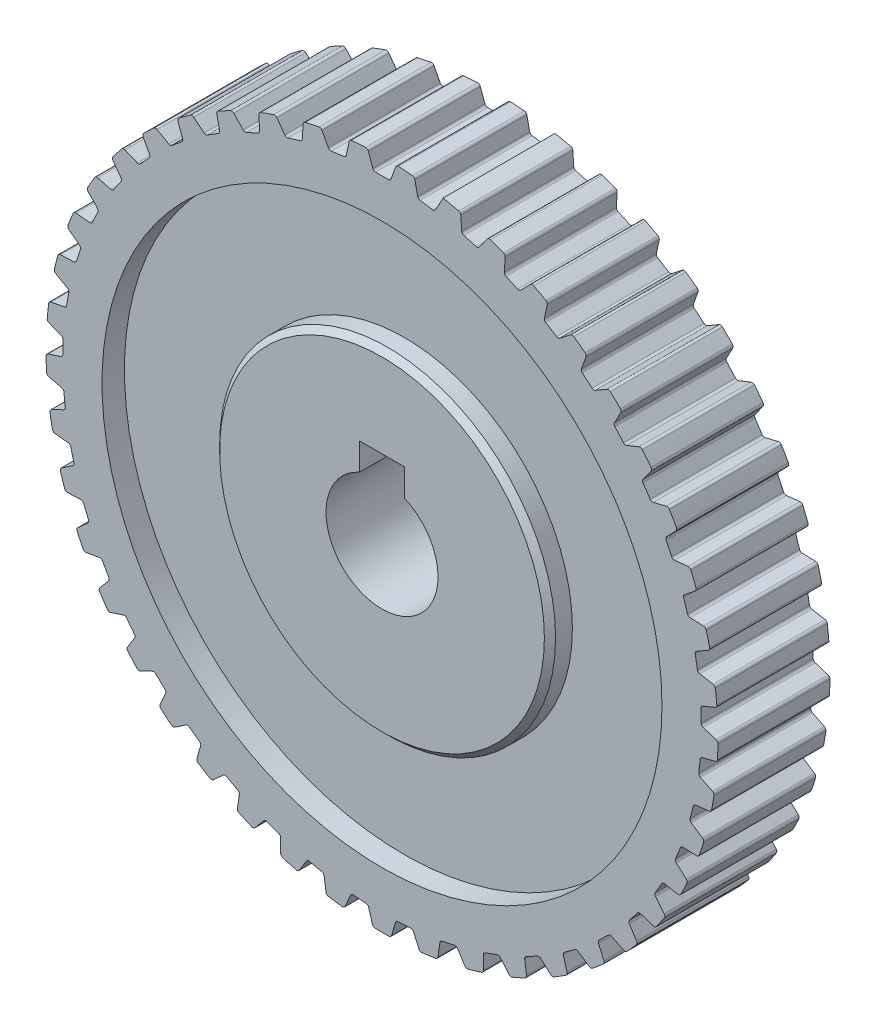
from build123d import *

# Parameters (mm, degrees)
SKETCH1_R               = 30
BOSS_EXTRUDE1_DEPTH     = 5
CUT_EXTRUDE1_START      = 44.588989435
CUT_EXTRUDE1_DEPTH      = 54.588989435
CIRPATTERN1_COUNT       = 45
SKETCH3_R               = 25
SKETCH3_R_2             = 15
CUT_EXTRUDE_THIN1_DEPTH = 2
CHAMFER1_SIZE           = 0.5
FILLET1_R               = 0.25


with BuildPart() as part:
    # Sketch1 → Boss-Extrude1 (new, symmetric)
    with BuildSketch(Plane.XY):
        Circle(SKETCH1_R)
        with BuildLine():
            Line((-2, 7), (2, 7))
            Line((2, 7), (2, 4.582575695))
            ThreePointArc((2, 4.582575695), (0, -5), (-2, 4.582575695))
            Line((-2, 4.582575695), (-2, 7))
        make_face(mode=Mode.SUBTRACT)
    extrude(amount=BOSS_EXTRUDE1_DEPTH, both=True)

    # Sketch2 → Cut-Extrude1 (cut)
    with BuildSketch(Plane.XY.offset(5).offset(CUT_EXTRUDE1_START)):
        with BuildLine():
            Line((-0.75, 28.5), (0.75, 28.5))
            Line((0.75, 28.5), (1.285919783, 29.972427501))
            ThreePointArc((1.285919783, 29.972427501), (0, 30), (-1.285919783, 29.972427501))
            Line((-1.285919783, 29.972427501), (-0.75, 28.5))
        make_face()
    cut_extrude1 = extrude(amount=-CUT_EXTRUDE1_DEPTH, mode=Mode.SUBTRACT)

    # CirPattern1: Cut-Extrude1 ×45 about axis
    cirpattern1_axis = Axis((0, 0, 5), (0, 0, 1))
    for i in range(1, CIRPATTERN1_COUNT):
        add(cut_extrude1.rotate(cirpattern1_axis, i * 360 / CIRPATTERN1_COUNT), mode=Mode.SUBTRACT)

    # Sketch3 → Cut-Extrude-Thin1 (cut)
    with BuildSketch(Plane.XY.offset(5)):
        Circle(SKETCH3_R)
        Circle(SKETCH3_R_2, mode=Mode.SUBTRACT)
    cut_extrude_thin1 = extrude(amount=-CUT_EXTRUDE_THIN1_DEPTH, mode=Mode.SUBTRACT)

    # Mirror1: Cut-Extrude-Thin1 across plane
    add(cut_extrude_thin1.mirror(Plane.XY), mode=Mode.SUBTRACT)

    # Chamfer1
    chamfer1_edges = [part.edges().sort_by_distance(p)[0] for p in [
        (-15, 0, -5),
        (-15, 0, 5),
    ]]
    chamfer(chamfer1_edges, length=CHAMFER1_SIZE)

    # Fillet1
    fillet1_edges = [part.edges().sort_by_distance(p)[0] for p in [
        (28.265477671, -3.724952625, 0),
        (28.422270365, -2.233169782, 0),
        (29.942650626, -1.854096408, 0),
        (29.999047061, -0.2391138, 0),
        (28.508813193, 0.245092536, 0),
        (28.456463948, 1.744178776, 0),
        (29.909291155, 2.33115907, 0),
        (29.740376607, 3.938273644, 0),
        (28.197257094, 4.210367249, 0),
        (27.936784828, 5.687578878, 0),
        (29.293781353, 6.471041187, 0),
        (28.90284355, 8.039007072, 0),
        (27.33687346, 8.093691952, 0),
        (26.873347969, 9.520276727, 0),
        (28.108101418, 10.484971849, 0),
        (27.502749521, 11.983270371, 0),
        (25.94440868, 11.819482149, 0),
        (25.286851959, 13.167673218, 0),
        (26.375329261, 14.29482446, 0),
        (25.567345756, 15.694292943, 0),
        (24.046965495, 15.31521957, 0),
        (23.20817614, 16.558775928, 0),
        (24.129191322, 17.826444573, 0),
        (23.134302688, 19.099843956, 0),
        (21.681475481, 18.512863662, 0),
        (20.677779571, 19.6275809, 0),
        (21.413406121, 21.01109322, 0),
        (20.250976734, 22.133638231, 0),
        (18.893980208, 21.350175922, 0),
        (17.744913544, 22.314357336, 0),
        (18.280833326, 23.786784837, 0),
        (16.973488552, 24.736626415, 0),
        (15.738735103, 23.771931292, 0),
        (14.466662959, 24.566810189, 0),
        (14.792444905, 26.099493745, 0),
        (13.365630723, 26.858144303, 0),
        (12.277153421, 25.730993061, 0),
        (10.906835234, 26.341098025, 0),
        (11.01613837, 27.904205694, 0),
        (9.497626095, 28.456898963, 0),
        (8.576610913, 27.189230317, 0),
        (7.134718369, 27.602686351, 0),
        (4.709134429, 28.118260133, 0),
        (3.223732326, 28.327019785, 0),
        (2.897950379, 29.859703341, 0),
        (1.285919783, 29.972427501, 0),
        (0.75, 28.5, 0),
        (-0.75, 28.5, 0),
        (-1.285919783, 29.972427501, 0),
        (-2.897950379, 29.859703341, 0),
        (-3.223732326, 28.327019785, 0),
        (-4.709134429, 28.118260133, 0),
        (-5.444760978, 29.501772453, 0),
        (-7.025415233, 29.16579402, 0),
        (-7.134718369, 27.602686351, 0),
        (-8.576610913, 27.189230317, 0),
        (-9.497626095, 28.456898963, 0),
        (-11.01613837, 27.904205694, 0),
        (-10.906835234, 26.341098025, 0),
        (-12.277153421, 25.730993061, 0),
        (-13.365630723, 26.858144303, 0),
        (-14.792444905, 26.099493745, 0),
        (-14.466662959, 24.566810189, 0),
        (-15.738735103, 23.771931292, 0),
        (-16.973488552, 24.736626415, 0),
        (-18.280833326, 23.786784837, 0),
        (-17.744913544, 22.314357336, 0),
        (-18.893980208, 21.350175922, 0),
        (-20.250976734, 22.133638231, 0),
        (-21.413406121, 21.01109322, 0),
        (-20.677779571, 19.6275809, 0),
        (-21.681475481, 18.512863662, 0),
        (-23.134302688, 19.099843956, 0),
        (-24.129191322, 17.826444573, 0),
        (-23.20817614, 16.558775928, 0),
        (-24.046965495, 15.31521957, 0),
        (-25.567345756, 15.694292943, 0),
        (-26.375329261, 14.29482446, 0),
        (-25.286851959, 13.167673218, 0),
        (-25.94440868, 11.819482149, 0),
        (-27.502749521, 11.983270371, 0),
        (-28.108101418, 10.484971849, 0),
        (-26.873347969, 9.520276727, 0),
        (-27.33687346, 8.093691952, 0),
        (-28.90284355, 8.039007072, 0),
        (-29.293781353, 6.471041187, 0),
        (-27.936784828, 5.687578878, 0),
        (-28.197257094, 4.210367249, 0),
        (-29.740376607, 3.938273644, 0),
        (-29.909291155, 2.33115907, 0),
        (-28.456463948, 1.744178776, 0),
        (-28.508813193, 0.245092536, 0),
        (-29.999047061, -0.2391138, 0),
        (-29.942650626, -1.854096408, 0),
        (-28.422270365, -2.233169782, 0),
        (-28.265477671, -3.724952625, 0),
        (-29.673820188, -4.411847167, 0),
        (-29.393210462, -6.003264007, 0),
        (-27.834869621, -6.16705223, 0),
        (-27.471986777, -7.622495819, 0),
        (-28.771026159, -8.498708946, 0),
        (-28.27166489, -10.035584902, 0),
        (-26.7056948, -9.980900021, 0),
        (-26.14378491, -11.371675803, 0),
        (-27.308236832, -12.420153023, 0),
        (-26.59984352, -13.872574552, 0),
        (-25.056724008, -13.600480947, 0),
        (-24.306724008, -14.899519053, 0),
        (-25.313923738, -16.099852949, 0),
        (-24.410286453, -17.439550318, 0),
        (-22.920052584, -16.955343982, 0),
        (-21.996560371, -18.137360112, 0),
        (-22.826903912, -19.466187551, 0),
        (-21.745610926, -20.667085074, 0),
        (-20.337268408, -19.980190532, 0),
        (-19.258258708, -21.022178087, 0),
        (-19.895584367, -22.453634955, 0),
        (-18.657681818, -23.492358527, 0),
        (-17.358642436, -22.6161454, 0),
        (-16.145116945, -23.497823279, 0),
        (-16.577019903, -25.004047895, 0),
        (-15.206602156, -25.860379944, 0),
        (-14.042150234, -24.811902724, 0),
        (-12.717728845, -25.516110069, 0),
        (-12.935802603, -27.067785484, 0),
        (-11.45954328, -27.725058482, 0),
        (-10.45234355, -26.524724585, 0),
        (-9.042804619, -27.0377548, 0),
        (-9.042804619, -28.604679418, 0),
        (-7.48943743, -29.050100292, 0),
        (-6.659093889, -27.721272853, 0),
        (-5.191872488, -28.033140389, 0),
        (-4.97379873, -29.584815805, 0),
        (-3.373558199, -29.809714945, 0),
        (-2.736232539, -28.378258077, 0),
        (-1.239886464, -28.482892788, 0),
        (-0.807983505, -29.989117404, 0),
        (0.807983505, -29.989117404, 0),
        (1.239886464, -28.482892788, 0),
        (2.736232539, -28.378258077, 0),
        (3.373558199, -29.809714945, 0),
        (4.97379873, -29.584815805, 0),
        (5.191872488, -28.033140389, 0),
        (6.659093889, -27.721272853, 0),
        (7.48943743, -29.050100292, 0),
        (9.042804619, -28.604679418, 0),
        (9.042804619, -27.0377548, 0),
        (10.45234355, -26.524724585, 0),
        (11.45954328, -27.725058482, 0),
        (12.935802603, -27.067785484, 0),
        (12.717728845, -25.516110069, 0),
        (14.042150234, -24.811902724, 0),
        (15.206602156, -25.860379944, 0),
        (16.577019903, -25.004047895, 0),
        (16.145116945, -23.497823279, 0),
        (17.358642436, -22.6161454, 0),
        (18.657681818, -23.492358527, 0),
        (19.895584367, -22.453634955, 0),
        (19.258258708, -21.022178087, 0),
        (20.337268408, -19.980190532, 0),
        (21.745610926, -20.667085074, 0),
        (22.826903912, -19.466187551, 0),
        (21.996560371, -18.137360112, 0),
        (22.920052584, -16.955343982, 0),
        (24.410286453, -17.439550318, 0),
        (25.313923738, -16.099852949, 0),
        (24.306724008, -14.899519053, 0),
        (25.056724008, -13.600480947, 0),
        (26.59984352, -13.872574552, 0),
        (27.308236832, -12.420153023, 0),
        (26.14378491, -11.371675803, 0),
        (26.7056948, -9.980900021, 0),
        (28.27166489, -10.035584902, 0),
        (28.771026159, -8.498708946, 0),
        (27.471986777, -7.622495819, 0),
        (27.834869621, -6.16705223, 0),
        (29.393210462, -6.003264007, 0),
        (29.673820188, -4.411847167, 0),
        (7.025415233, 29.16579402, 0),
    ]]
    fillet(fillet1_edges, radius=FILLET1_R)


solid = part.part
